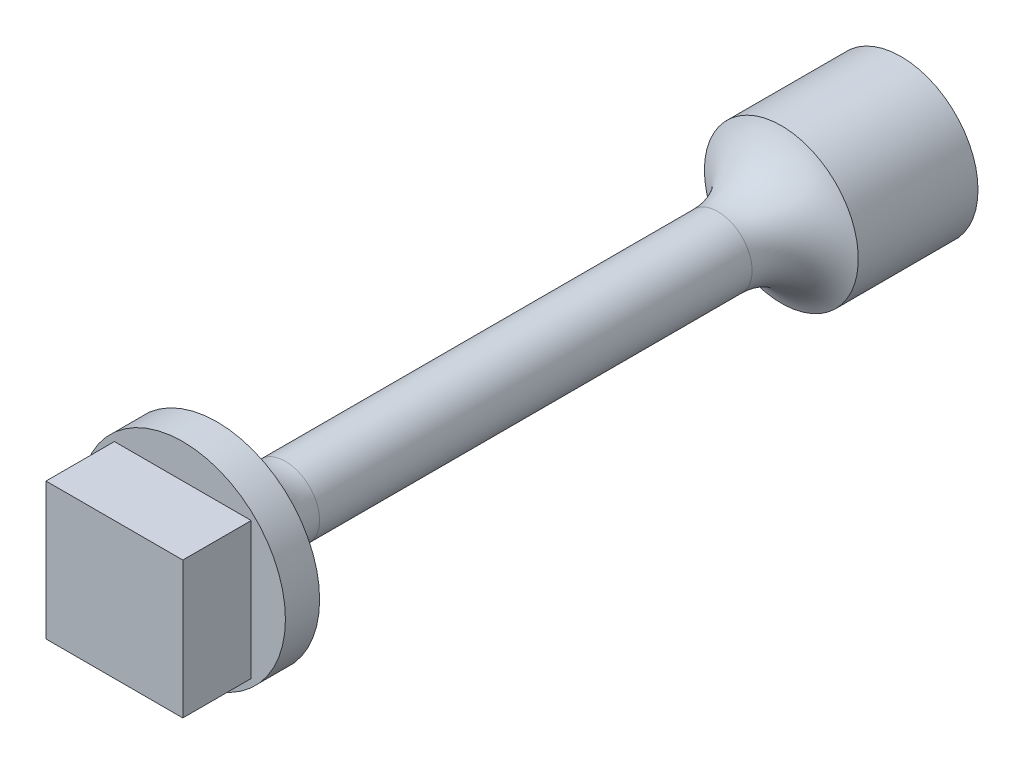
from build123d import *

# Parameters (mm, degrees)
SKETCH_1_R          = 2.25
EXTRUDE_2_DEPTH     = 20
SKETCH_7_W          = 2.4
SKETCH_7_H          = 2.4
CUT_EXTRUDE_3_DEPTH = 2.5
SKETCH_9_R          = 3
EXTRUDE_4_DEPTH     = 1
SKETCH_10_W         = 4
SKETCH_10_H         = 4
EXTRUDE_5_DEPTH     = 2
CUT_EXTRUDE_START   = -20
SKETCH_12_OUTSIDE_W = 12.904
SKETCH_12_OUTSIDE_H = 12.904
SKETCH_12_OUTSIDE_R = 1
CUT_EXTRUDE_4_DEPTH = 16.5
FILLET_1_R          = 2


with BuildPart() as part:
    # 草图1 → 凸台-拉伸2 (new body)
    with BuildSketch(Plane.XY):
        Circle(SKETCH_1_R)
    extrude(amount=EXTRUDE_2_DEPTH)

    # 草图7 → 切除-拉伸3 (cut)
    with BuildSketch(Plane.XY):
        Rectangle(SKETCH_7_W, SKETCH_7_H)
    extrude(amount=CUT_EXTRUDE_3_DEPTH, mode=Mode.SUBTRACT)

    # 草图9 → 凸台-拉伸4 (add)
    with BuildSketch(Plane.XY.offset(20)):
        Circle(SKETCH_9_R)
    extrude(amount=EXTRUDE_4_DEPTH)

    # 草图10 → 凸台-拉伸5 (add)
    with BuildSketch(Plane.XY.offset(21)):
        Rectangle(SKETCH_10_W, SKETCH_10_H)
    extrude(amount=EXTRUDE_5_DEPTH)

    # 草图12 outside → 切除-拉伸4 (cut)
    with BuildSketch(Plane(origin=(0, 0, 0), x_dir=(-1, 0, 0), z_dir=(0, 0, -1)).offset(CUT_EXTRUDE_START)):
        Rectangle(SKETCH_12_OUTSIDE_W, SKETCH_12_OUTSIDE_H)
        with Locations(Location((0, 0, 0), (0, 0, 180))):
            Circle(SKETCH_12_OUTSIDE_R, mode=Mode.SUBTRACT)
    extrude(amount=CUT_EXTRUDE_4_DEPTH, mode=Mode.SUBTRACT)

    # 圆角1
    # the kernel refuses this fillet: 2 mm, written as the material it adds along each edge
    with BuildSketch(Plane(origin=(0, 0, 3.5), x_dir=(1, 0, 0), z_dir=(0, 1, 0))) as fillet_1_piece_1:
        with BuildLine():
            CenterArc((3, -1.854049622), FILLET_1_R, 112.024312837, 67.975687163)
            Line((2.25, 0), (2.235, 0.037080992))
            ThreePointArc((2.235, 0.037080992), (1.625, 0.04), (1, 0.04))
            Line((1, 0.04), (0.96, 0))
            Line((0.96, 0), (0.96, -1.854049622))
            Line((0.96, -1.854049622), (1, -1.854049622))
        make_face()
    revolve(axis=Axis((0, 0, 3.5), (0, 0, -1)))
    with BuildSketch(Plane(origin=(0, 0, 20), x_dir=(1, 0, 0), z_dir=(0, 1, 0))) as fillet_1_piece_2:
        with BuildLine():
            CenterArc((1 + FILLET_1_R, FILLET_1_R), FILLET_1_R, 180, 90)
            Line((1, FILLET_1_R), (1 - FILLET_1_R * 0.02, FILLET_1_R))
            Line((1 - FILLET_1_R * 0.02, FILLET_1_R), (1 - FILLET_1_R * 0.02, -FILLET_1_R * 0.02))
            Line((1 - FILLET_1_R * 0.02, -FILLET_1_R * 0.02), (1 + FILLET_1_R, -FILLET_1_R * 0.02))
            Line((1 + FILLET_1_R, -FILLET_1_R * 0.02), (1 + FILLET_1_R, 0))
        make_face()
    revolve(axis=Axis((0, 0, 20), (0, 0, -1)))


solid = part.part
